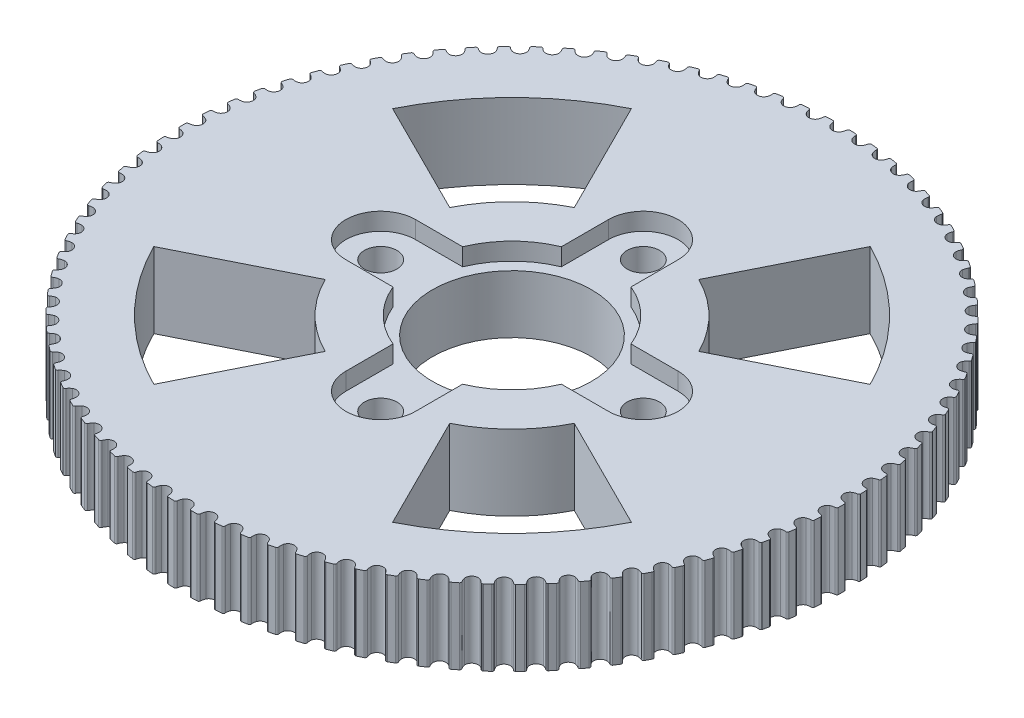
from build123d import *

# Parameters (mm, degrees)
SKETCH2_R           = 28.39
SKETCH2_R_2         = 23
SKETCH2_R_3         = 6.85
BOSS_EXTRUDE1_DEPTH = 6.5
CIRPATTERN1_DEPTH   = 6.5
CUT_EXTRUDE1_START  = -10
CUT_EXTRUDE1_DEPTH  = 10
CIRPATTERN2_COUNT   = 90
CUT_EXTRUDE3_START  = -1.5
CUT_EXTRUDE3_DEPTH  = 1.5
SKETCH5_R           = 1.4
CUT_EXTRUDE4_DEPTH  = 1.5
SKETCH5_2_R         = 1.4
CUT_EXTRUDE5_DEPTH  = 41.665948361


# Read off the part's stored shape, not the designer's step: CirPattern1, Cut-Extrude3
with BuildPart() as part:
    # Sketch2 → Boss-Extrude1 (new body)
    # profile 1 of 3: a face of its own
    with BuildSketch(Plane(origin=(0, 0, 0), x_dir=(1, 0, 0), z_dir=(0, 1, 0))):
        with Locations(Location((0, 0, 0), (0, 0, 90))):
            Circle(SKETCH2_R)
        Circle(SKETCH2_R_2, mode=Mode.SUBTRACT)
    # profile 2 of 3: a face of its own
    with BuildSketch(Plane(origin=(0, 0, 0), x_dir=(1, 0, 0), z_dir=(0, 1, 0))):
        with BuildLine():
            ThreePointArc((23, 0), (12.090970622, 19.565490779), (-10.287689514, 20.570936889))
            Line((-10.287689514, 20.570936889), (-5.367490181, 10.732662724))
            ThreePointArc((-5.367490181, 10.732662724), (6.308332499, 10.208082145), (12, 0))
            ThreePointArc((12, 0), (-2.75753942, -11.678868796), (-10.732662724, 5.367490181))
            Line((-10.732662724, 5.367490181), (-20.570936889, 10.287689514))
            ThreePointArc((-20.570936889, 10.287689514), (-5.285283889, -22.384498525), (23, 0))
        make_face()
    # profile 3 of 3: a face of its own
    with BuildSketch(Plane(origin=(0, 0, 0), x_dir=(1, 0, 0), z_dir=(0, 1, 0))):
        with BuildLine():
            ThreePointArc((12, 0), (6.308332499, 10.208082145), (-5.367490181, 10.732662724))
            ThreePointArc((-5.367490181, 10.732662724), (-8.485281374, 8.485281374), (-10.732662724, 5.367490181))
            ThreePointArc((-10.732662724, 5.367490181), (-2.75753942, -11.678868796), (12, 0))
        make_face()
        with Locations(Location((0, 0, 0), (0, 0, 90))):
            Circle(SKETCH2_R_3, mode=Mode.SUBTRACT)
    extrude(amount=BOSS_EXTRUDE1_DEPTH)

    # CirPattern1 outline → CirPattern1 (cut)
    with BuildSketch(Plane(origin=(0, 0, 0), x_dir=(1, 0, 0), z_dir=(0, 1, 0))):
        with BuildLine():
            ThreePointArc((-20.570936889, -10.287689514), (-16.263455967, -16.263455967), (-10.287689514, -20.570936889))
            Line((-10.287689514, -20.570936889), (-5.367490181, -10.732662724))
            ThreePointArc((-5.367490181, -10.732662724), (-8.485281374, -8.485281374), (-10.732662724, -5.367490181))
            Line((-10.732662724, -5.367490181), (-20.570936889, -10.287689514))
        make_face()
        with BuildLine():
            ThreePointArc((10.287689514, -20.570936889), (16.263455967, -16.263455967), (20.570936889, -10.287689514))
            Line((20.570936889, -10.287689514), (10.732662724, -5.367490181))
            ThreePointArc((10.732662724, -5.367490181), (8.485281374, -8.485281374), (5.367490181, -10.732662724))
            Line((5.367490181, -10.732662724), (10.287689514, -20.570936889))
        make_face()
        with BuildLine():
            ThreePointArc((20.570936889, 10.287689514), (16.263455967, 16.263455967), (10.287689514, 20.570936889))
            Line((10.287689514, 20.570936889), (5.367490181, 10.732662724))
            ThreePointArc((5.367490181, 10.732662724), (8.485281374, 8.485281374), (10.732662724, 5.367490181))
            Line((10.732662724, 5.367490181), (20.570936889, 10.287689514))
        make_face()
    extrude(amount=CIRPATTERN1_DEPTH, mode=Mode.SUBTRACT)

    # Sketch3 → Cut-Extrude1 (cut)
    with BuildSketch(Plane(origin=(0, 6.5, 0), x_dir=(1, 0, 0), z_dir=(0, 1, 0)).offset(CUT_EXTRUDE1_START)):
        with BuildLine():
            ThreePointArc((0.738659526, 28.380389041), (0.010570113, 28.389998032), (-0.717526252, 28.380931205))
            Line((-0.717526252, 28.380931205), (-0.719249576, 28.379636089))
            ThreePointArc((-0.719249576, 28.379636089), (-0.628259376, 28.336072689), (-0.585439071, 28.244730433))
            ThreePointArc((-0.585439071, 28.244730433), (-0.547244395, 28.050762375), (-0.471637345, 27.86809871))
            ThreePointArc((-0.471637345, 27.86809871), (0, 27.610012345), (0.471637345, 27.86809871))
            ThreePointArc((0.471637345, 27.86809871), (0.547244395, 28.050762375), (0.585439071, 28.244730433))
            ThreePointArc((0.585439071, 28.244730433), (0.635322418, 28.342746577), (0.738659526, 28.380389041))
        make_face()
    cut_extrude1 = extrude(amount=CUT_EXTRUDE1_DEPTH, mode=Mode.SUBTRACT)

    # CirPattern2: Cut-Extrude1 ×90 about axis
    cirpattern2_axis = Axis((0, 0, 0), (0, 1, 0))
    for i in range(1, CIRPATTERN2_COUNT):
        add(cut_extrude1.rotate(cirpattern2_axis, i * 360 / CIRPATTERN2_COUNT), mode=Mode.SUBTRACT)

    # Cut-Extrude3 outline → Cut-Extrude3 (cut)
    with BuildSketch(Plane(origin=(0, 6.5, 0), x_dir=(1, 0, 0), z_dir=(0, 1, 0)).offset(CUT_EXTRUDE3_START)):
        with BuildLine():
            Line((3, -6.158124715), (3, -7.254136751))
            ThreePointArc((3, -7.254136751), (0, 7.85), (-3, -7.254136751))
            Line((-3, -7.254136751), (-3, -6.158124715))
            ThreePointArc((-3, -6.158124715), (0, 6.85), (3, -6.158124715))
        make_face()
    extrude(amount=CUT_EXTRUDE3_DEPTH, mode=Mode.SUBTRACT)

    # Sketch5 → Cut-Extrude4 (cut)
    with BuildSketch(Plane(origin=(0, 6.5, 0), x_dir=(1, 0, 0), z_dir=(0, 1, 0))):
        with BuildLine():
            Line((-11.313708499, 3), (-3, 3))
            Line((-3, 3), (-3, 11.313708499))
            ThreePointArc((-3, 11.313708499), (0, 14.313708499), (3, 11.313708499))
            Line((3, 11.313708499), (3, 3))
            Line((3, 3), (11.313708499, 3))
            ThreePointArc((11.313708499, 3), (14.313708499, 0), (11.313708499, -3))
            Line((11.313708499, -3), (3, -3))
            Line((3, -3), (3, -11.313708499))
            ThreePointArc((3, -11.313708499), (0, -14.313708499), (-3, -11.313708499))
            Line((-3, -11.313708499), (-3, -3))
            Line((-3, -3), (-11.313708499, -3))
            ThreePointArc((-11.313708499, -3), (-14.313708499, 0), (-11.313708499, 3))
        make_face()
        with Locations(Location((11.313708499, 0, 0), (0, 0, 270))):
            Circle(SKETCH5_R, mode=Mode.SUBTRACT)
        with Locations(Location((0, 11.313708499, 0), (0, 0, 270))):
            Circle(SKETCH5_R, mode=Mode.SUBTRACT)
        with Locations(Location((-11.313708499, 0, 0), (0, 0, 270))):
            Circle(SKETCH5_R, mode=Mode.SUBTRACT)
        with Locations(Location((0, -11.313708499, 0), (0, 0, 270))):
            Circle(SKETCH5_R, mode=Mode.SUBTRACT)
    extrude(amount=-CUT_EXTRUDE4_DEPTH, mode=Mode.SUBTRACT)

    # Sketch5<2> → Cut-Extrude5 (cut, through all)
    with BuildSketch(Plane(origin=(0, 6.5, 0), x_dir=(1, 0, 0), z_dir=(0, 1, 0))):
        with Locations(Location((0, -11.313708499, 0), (0, 0, 270))):
            Circle(SKETCH5_2_R)
        with Locations(Location((11.313708499, 0, 0), (0, 0, 270))):
            Circle(SKETCH5_2_R)
        with Locations(Location((0, 11.313708499, 0), (0, 0, 270))):
            Circle(SKETCH5_2_R)
        with Locations(Location((-11.313708499, 0, 0), (0, 0, 270))):
            Circle(SKETCH5_2_R)
    extrude(amount=-CUT_EXTRUDE5_DEPTH, mode=Mode.SUBTRACT)


solid = part.part
